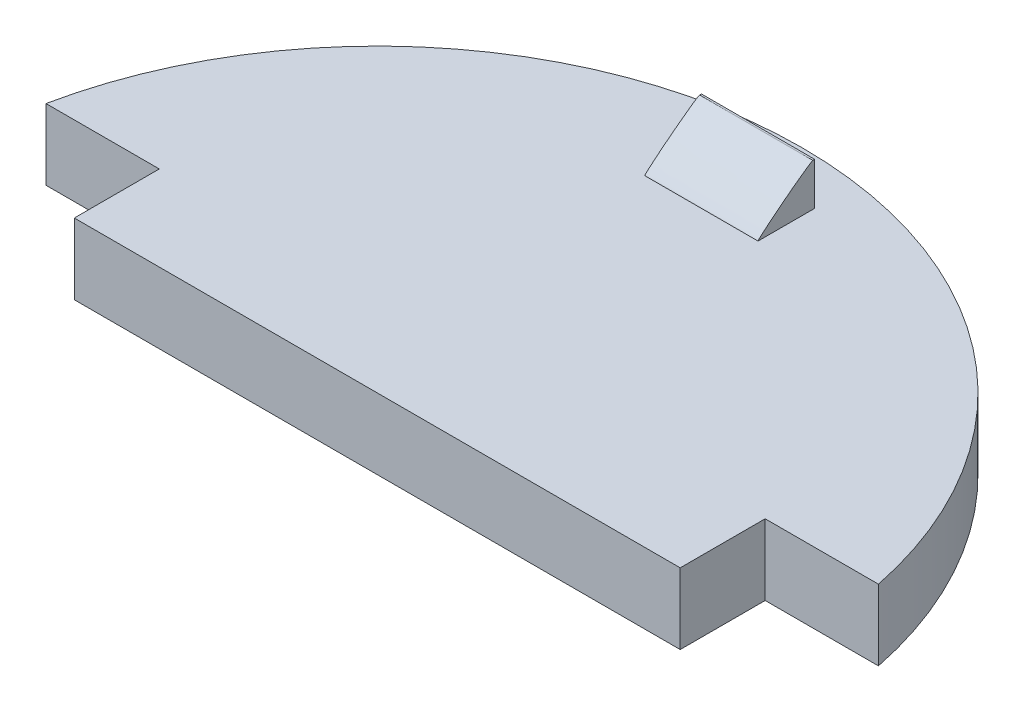
from build123d import *

# Parameters (mm, degrees)
BOSS_EXTRUDE1_DEPTH = 5
SKETCH3_W           = 8
SKETCH3_H           = 4
BOSS_EXTRUDE2_DEPTH = 3
FILLET1_START       = -3.841593316
FILLET1_DEPTH       = 8
CUT_EXTRUDE1_START  = -10
CUT_EXTRUDE1_DEPTH  = 10


with BuildPart() as part:
    # Sketch1 → Boss-Extrude1 (new body)
    with BuildSketch(Plane(origin=(0, 0, 0), x_dir=(1, 0, 0), z_dir=(0, 1, 0))):
        with BuildLine():
            Line((-30, 0), (30, 0))
            ThreePointArc((30, 0), (0, 30), (-30, 0))
        make_face()
    extrude(amount=BOSS_EXTRUDE1_DEPTH)

    # Sketch3 → Boss-Extrude2 (add)
    with BuildSketch(Plane(origin=(0, 5, 0), x_dir=(1, 0, 0), z_dir=(0, 1, 0))):
        with Locations((0.158406684, 24.731666579)):
            Rectangle(SKETCH3_W, SKETCH3_H)
    extrude(amount=BOSS_EXTRUDE2_DEPTH)

    # Fillet1: read off the stored shape, not the designer's step
    # Fillet1 outline → Fillet1 (cut)
    with BuildSketch(Plane.YZ.offset(FILLET1_START)):
        with BuildLine():
            Line((8, -22.731666579), (5, -22.731666579))
            add(Edge.make_bspline(
                [(5, -22.731666579), (8, -23.506263249), (8, -26.604649926)],
                knots=[0, 0, 0, 1, 1, 1], degree=2, weights=[1, 0.057495957, 1]))
            Line((8, -26.604649926), (8, -22.731666579))
        make_face()
    extrude(amount=FILLET1_DEPTH, mode=Mode.SUBTRACT)

    # Sketch5 → Cut-Extrude1 (cut)
    with BuildSketch(Plane(origin=(0, 5, 0), x_dir=(1, 0, 0), z_dir=(0, 1, 0)).offset(CUT_EXTRUDE1_START)):
        with BuildLine():
            Line((-21.393876913, 0), (-21.393876913, 6))
            Line((-21.393876913, 6), (-29.393876913, 6))
            ThreePointArc((-29.393876913, 6), (-29.84808459, 3.01526886), (-30, 0))
            Line((-30, 0), (-21.393876913, 0))
        make_face()
        with BuildLine():
            Line((21.393876913, 6), (29.393876913, 6))
            ThreePointArc((29.393876913, 6), (29.84808459, 3.01526886), (30, 0))
            Line((30, 0), (21.393876913, 0))
            Line((21.393876913, 0), (21.393876913, 6))
        make_face()
    extrude(amount=CUT_EXTRUDE1_DEPTH, mode=Mode.SUBTRACT)


solid = part.part
